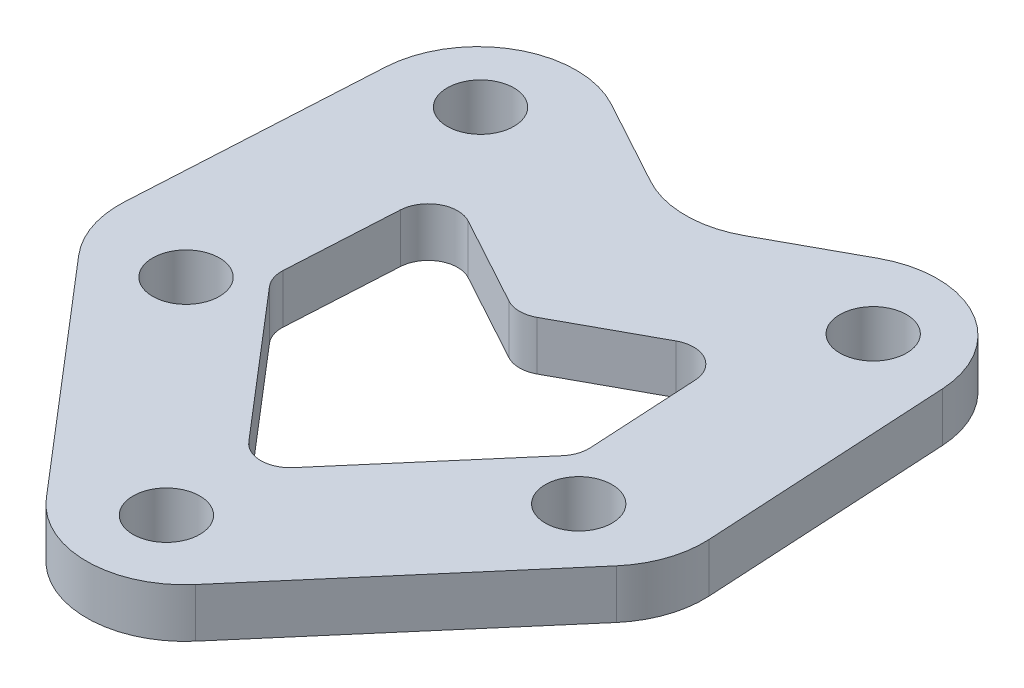
from build123d import *

# Parameters (mm, degrees)
BOSS_EXTRUDE1_DEPTH = 3.175
SKETCH2_R           = 2.159
CUT_EXTRUDE1_DEPTH  = 38.162422217
CUT_EXTRUDE2_DEPTH  = 38.162422217
FILLET1_R           = 6.35
FILLET2_R           = 1.905


with BuildPart() as part:
    # Sketch1 → Boss-Extrude1 (new body)
    with BuildSketch(Plane(origin=(0, 0, 0), x_dir=(1, 0, 0), z_dir=(0, 1, 0))):
        Polygon((-17.4625, 31.75), (0, 22.225), (17.4625, 31.75), (19.05, 3.175), (0, -19.05), (-19.05, 3.175), align=None)
    extrude(amount=BOSS_EXTRUDE1_DEPTH)

    # Sketch2 → Cut-Extrude1 (cut, through all)
    with BuildSketch(Plane(origin=(0, 3.175, 0), x_dir=(1, 0, 0), z_dir=(0, 1, 0))):
        with Locations((0, -10.4775)):
            Circle(SKETCH2_R)
        with Locations((-12.7, 3.4925)):
            Circle(SKETCH2_R)
        with Locations((12.7, 3.4925)):
            Circle(SKETCH2_R)
        with Locations((-12.7, 22.5425)):
            Circle(SKETCH2_R)
        with Locations((12.7, 22.5425)):
            Circle(SKETCH2_R)
    extrude(amount=-CUT_EXTRUDE1_DEPTH, mode=Mode.SUBTRACT)

    # Sketch3 → Cut-Extrude2 (cut, through all)
    with BuildSketch(Plane(origin=(0, 3.175, 0), x_dir=(1, 0, 0), z_dir=(0, 1, 0))):
        Polygon((-9.366701395, 17.207620695), (-9.975545431, 6.248428041), (0, -5.389708296), (9.975545431, 6.248428041), (9.366701395, 17.207620695), (0, 12.098510843), align=None)
    extrude(amount=-CUT_EXTRUDE2_DEPTH, mode=Mode.SUBTRACT)

    # Fillet1
    fillet1_edges = [part.edges().sort_by_distance(p)[0] for p in [
        (-19.05, 1.5875, -3.175),
        (0, 1.5875, 19.05),
        (19.05, 1.5875, -3.175),
        (17.4625, 1.5875, -31.75),
        (-17.4625, 1.5875, -31.75),
        (0, 1.5875, -22.225),
    ]]
    fillet(fillet1_edges, radius=FILLET1_R)

    # Fillet2
    fillet2_edges = [part.edges().sort_by_distance(p)[0] for p in [
        (-9.975545431, 1.5875, -6.248428041),
        (-9.366701395, 1.5875, -17.207620695),
        (0, 1.5875, -12.098510843),
        (9.366701395, 1.5875, -17.207620695),
        (9.975545431, 1.5875, -6.248428041),
        (0, 1.5875, 5.389708296),
    ]]
    fillet(fillet2_edges, radius=FILLET2_R)


solid = part.part
